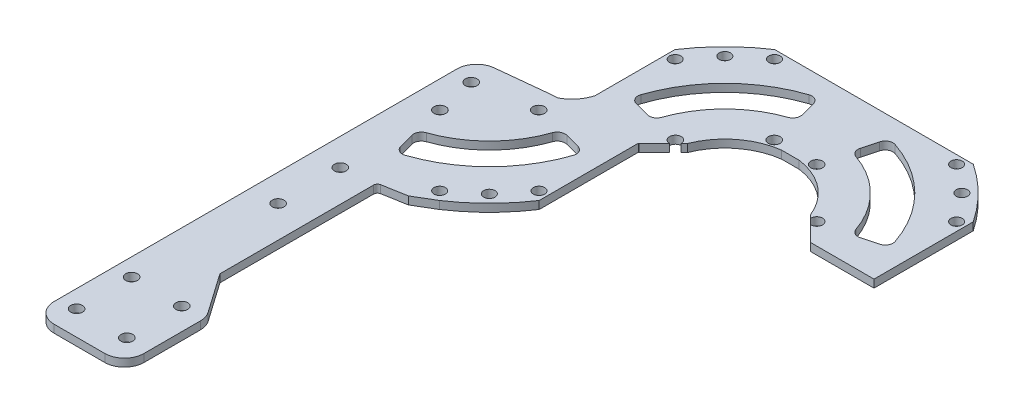
from build123d import *

# Parameters (mm, degrees)
SKETCH1_R           = 1.5
SKETCH1_R_2         = 1.45
BOSS_EXTRUDE1_DEPTH = 2
SKETCH_1_R          = 1.45
SKETCH_1_R_2        = 1.5
EXTRUDE_1_DEPTH     = 2
EXTRUDE_2_DEPTH     = 2
FILLET1_R           = 1


with BuildPart() as part:
    # Sketch1 → Boss-Extrude1 (new body)
    with BuildSketch(Plane(origin=(0, 0, 0), x_dir=(1, 0, 0), z_dir=(0, 1, 0))):
        with BuildLine():
            Line((-21.192961085, -132.078714637), (-21.192961085, -166.219718768))
            Line((-21.192961085, -166.219718768), (-14.185358568, -176.236618152))
            ThreePointArc((-14.185358568, -176.236618152), (-13.513427934, -177.60024794), (-13.282330236, -179.10276943))
            Line((-13.282330236, -179.10276943), (-13.282330236, -193.470906367))
            ThreePointArc((-13.282330236, -193.470906367), (-14.74679633, -197.006440273), (-18.282330236, -198.470906367))
            Line((-18.282330236, -198.470906367), (-21.77517331, -198.470906367))
            Line((-21.77517331, -198.470906367), (-31.192961085, -198.470906367))
            ThreePointArc((-31.192961085, -198.470906367), (-34.728494991, -197.006440273), (-36.192961085, -193.470906367))
            Line((-36.192961085, -193.470906367), (-36.192961085, -90.830339434))
            ThreePointArc((-36.192961085, -90.830339434), (-34.909297601, -87.485366654), (-31.717423925, -85.857921639))
            Line((-31.717423925, -85.857921639), (-19.324348326, -84.550769285))
            Line((-19.324348326, -84.550769285), (-12.49642386, -84.082177413))
            Line((-12.49642386, -84.082177413), (3.10357614, -84.082177413))
            Line((3.10357614, -84.082177413), (3.307038915, -84.078714637))
            Line((3.307038915, -84.078714637), (3.307038915, -109.367146032))
            ThreePointArc((3.307038915, -109.367146032), (-2.41677201, -116.354903712), (-9.40452969, -122.078714637))
            Line((-9.40452969, -122.078714637), (-14.349438262, -125.02189202))
            Line((-14.349438262, -125.02189202), (-21.192961085, -126.237284003))
            Line((-21.192961085, -126.237284003), (-21.192961085, -132.078714637))
        make_face()
        with Locations((-18.919157596, -192.204354167)):
            Circle(SKETCH1_R, mode=Mode.SUBTRACT)
        with Locations((-18.919157596, -178.204354167)):
            Circle(SKETCH1_R, mode=Mode.SUBTRACT)
        with Locations((-31.717423925, -178.204354167)):
            Circle(SKETCH1_R, mode=Mode.SUBTRACT)
        with Locations((-31.717423925, -192.204354167)):
            Circle(SKETCH1_R, mode=Mode.SUBTRACT)
        with Locations((-29.287619577, -102.069022085)):
            Circle(SKETCH1_R, mode=Mode.SUBTRACT)
        with Locations((-16.702653636, -89.484056145)):
            Circle(SKETCH1_R, mode=Mode.SUBTRACT)
        with Locations((1.158345759, -107.272976806)):
            Circle(SKETCH1_R_2, mode=Mode.SUBTRACT)
        with Locations((-4.499501528, -114.272174194)):
            Circle(SKETCH1_R_2, mode=Mode.SUBTRACT)
        with Locations((-11.498698916, -119.930021481)):
            Circle(SKETCH1_R_2, mode=Mode.SUBTRACT)
        with Locations((-29.287619577, -127.462503818)):
            Circle(SKETCH1_R, mode=Mode.SUBTRACT)
        with Locations((-29.287619577, -143.302559608)):
            Circle(SKETCH1_R, mode=Mode.SUBTRACT)
        with Locations((-31.442028499, -91.953708305)):
            Circle(SKETCH1_R, mode=Mode.SUBTRACT)
        with BuildLine():
            Line((-3.683855698, -92.504640443), (-7.556212498, -91.467045565))
            ThreePointArc((-7.556212498, -91.467045565), (-9.011313317, -91.632215687), (-9.963793597, -92.744591918))
            ThreePointArc((-9.963793597, -92.744591918), (-16.148276393, -102.623399329), (-26.027083804, -108.807882125))
            ThreePointArc((-26.027083804, -108.807882125), (-27.139460035, -109.760362404), (-27.304630157, -111.215463223))
            Line((-27.304630157, -111.215463223), (-26.267035279, -115.087820024))
            ThreePointArc((-26.267035279, -115.087820024), (-25.280541686, -116.332651264), (-23.697816809, -116.465904366))
            ThreePointArc((-23.697816809, -116.465904366), (-10.491422144, -108.280253578), (-2.305771356, -95.073858913))
            ThreePointArc((-2.305771356, -95.073858913), (-2.439024458, -93.491134036), (-3.683855698, -92.504640443))
        make_face(mode=Mode.SUBTRACT)
    extrude(amount=BOSS_EXTRUDE1_DEPTH)

    # 草图1 → 凸台-拉伸1 (add)
    with BuildSketch(Plane.XZ):
        with BuildLine():
            Line((-12.69642386, 84.082177413), (-12.69642386, 58.793746018))
            ThreePointArc((-12.69642386, 58.793746018), (-6.972612935, 51.805988338), (0.015144745, 46.082177413))
            Line((0.015144745, 46.082177413), (25.30357614, 46.082177413))
            Line((25.30357614, 46.082177413), (50.592007535, 46.082177413))
            ThreePointArc((50.592007535, 46.082177413), (57.579765215, 51.805988338), (63.30357614, 58.793746018))
            Line((63.30357614, 58.793746018), (63.30357614, 84.078714637))
            Line((63.30357614, 84.078714637), (47.168942899, 84.078714637))
            Line((47.168942899, 84.078714637), (43.263289357, 80.173061094))
            ThreePointArc((43.263289357, 80.173061094), (44.35454376, 77.612712957), (41.794195623, 78.70396736))
            Line((41.794195623, 78.70396736), (40.962688124, 77.872459862))
            ThreePointArc((40.962688124, 77.872459862), (37.21418877, 72.168102006), (31.509830915, 68.419602653))
            ThreePointArc((31.509830915, 68.419602653), (29.563736563, 67.782199069), (27.554675458, 67.385664037))
            Line((27.554675458, 67.385664037), (23.052476821, 67.389126813))
            ThreePointArc((23.052476821, 67.389126813), (21.043415716, 67.785661845), (19.097321364, 68.423065428))
            ThreePointArc((19.097321364, 68.423065428), (13.392963509, 72.171564782), (9.644464155, 77.875922638))
            Line((9.644464155, 77.875922638), (8.812956657, 78.707430136))
            ThreePointArc((8.812956657, 78.707430136), (6.25260852, 77.616175733), (7.343862923, 80.17652387))
            Line((7.343862923, 80.17652387), (3.43820938, 84.082177413))
            Line((3.43820938, 84.082177413), (-12.69642386, 84.082177413))
        make_face()
        with Locations((61.154882984, 60.887915244)):
            Circle(SKETCH_1_R, mode=Mode.SUBTRACT)
        with Locations((55.497035696, 53.888717856)):
            Circle(SKETCH_1_R, mode=Mode.SUBTRACT)
        with Locations((48.497838309, 48.230870569)):
            Circle(SKETCH_1_R, mode=Mode.SUBTRACT)
        with Locations((30.708917648, 66.091869964)):
            Circle(SKETCH_1_R_2, mode=Mode.SUBTRACT)
        with Locations((2.109313971, 48.230870569)):
            Circle(SKETCH_1_R, mode=Mode.SUBTRACT)
        with Locations((-4.889883417, 53.888717856)):
            Circle(SKETCH_1_R, mode=Mode.SUBTRACT)
        with Locations((-10.547730705, 60.887915244)):
            Circle(SKETCH_1_R, mode=Mode.SUBTRACT)
        with Locations((19.898234632, 66.091869964)):
            Circle(SKETCH_1_R_2, mode=Mode.SUBTRACT)
        with BuildLine():
            Line((52.440324726, 76.693846485), (56.312681527, 75.656251607))
            ThreePointArc((56.312681527, 75.656251607), (57.557512766, 74.669758014), (57.690765869, 73.087033137))
            ThreePointArc((57.690765869, 73.087033137), (49.505115081, 59.880638472), (36.298720415, 51.694987684))
            ThreePointArc((36.298720415, 51.694987684), (34.715995538, 51.828240786), (33.729501945, 53.073072026))
            Line((33.729501945, 53.073072026), (32.691907068, 56.945428827))
            ThreePointArc((32.691907068, 56.945428827), (32.857077189, 58.400529646), (33.96945342, 59.353009925))
            ThreePointArc((33.96945342, 59.353009925), (43.848260831, 65.537492721), (50.032743627, 75.416300132))
            ThreePointArc((50.032743627, 75.416300132), (50.985223907, 76.528676363), (52.440324726, 76.693846485))
        make_face(mode=Mode.SUBTRACT)
        with BuildLine():
            Line((17.915245212, 56.945428827), (16.877650334, 53.073072026))
            ThreePointArc((16.877650334, 53.073072026), (15.891156741, 51.828240786), (14.308431864, 51.694987684))
            ThreePointArc((14.308431864, 51.694987684), (1.102037199, 59.880638472), (-7.083613589, 73.087033137))
            ThreePointArc((-7.083613589, 73.087033137), (-6.950360487, 74.669758014), (-5.705529247, 75.656251607))
            Line((-5.705529247, 75.656251607), (-1.833172447, 76.693846485))
            ThreePointArc((-1.833172447, 76.693846485), (-0.378071628, 76.528676363), (0.574408652, 75.416300132))
            ThreePointArc((0.574408652, 75.416300132), (6.758891448, 65.537492721), (16.637698859, 59.353009925))
            ThreePointArc((16.637698859, 59.353009925), (17.75007509, 58.400529646), (17.915245212, 56.945428827))
        make_face(mode=Mode.SUBTRACT)
    extrude(amount=-EXTRUDE_1_DEPTH)

    # 草图2 → 凸台-拉伸2 (add)
    with BuildSketch(Plane.XZ):
        with BuildLine():
            Line((-12.443677961, 84.250317512), (-17.409343258, 84.591104879))
            ThreePointArc((-17.409343258, 84.591104879), (-14.024568956, 81.869997058), (-12.443677961, 77.825011457))
            Line((-12.443677961, 77.825011457), (-12.443677961, 84.250317512))
        make_face()
    extrude(amount=-EXTRUDE_2_DEPTH)

    # Fillet1
    fillet1_edges = [part.edges().sort_by_distance(p)[0] for p in [
        (-21.192961085, 1, 126.237284003),
    ]]
    fillet(fillet1_edges, radius=FILLET1_R)


solid = part.part
